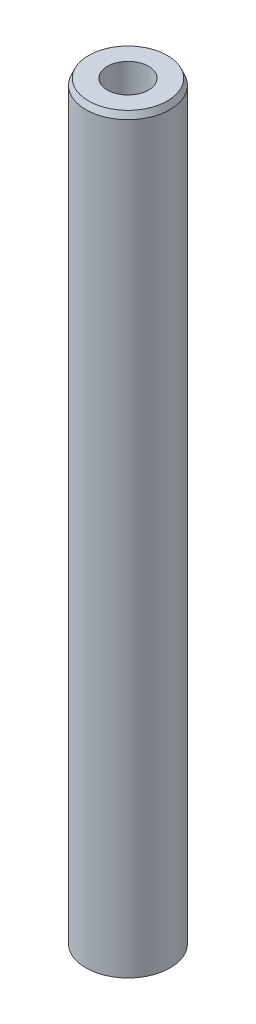
from build123d import *
from OCP.BRepFilletAPI import BRepFilletAPI_MakeChamfer

# Parameters (mm, degrees)
SKETCH1_R           = 12.5
BOSS_EXTRUDE1_DEPTH = 223.278673939
SKETCH2_R           = 6.114380376
CUT_EXTRUDE1_DEPTH  = 224.977378848
CHAMFER1_SIZE       = 1.834008935
CHAMFER1_SIZE2      = 0.799764475


with BuildPart() as part:
    # Sketch1 → Boss-Extrude1 (new body)
    with BuildSketch(Plane(origin=(0, 0, 0), x_dir=(1, 0, 0), z_dir=(0, 1, 0))):
        Circle(SKETCH1_R)
    extrude(amount=BOSS_EXTRUDE1_DEPTH)

    # Sketch2 → Cut-Extrude1 (cut, through all)
    with BuildSketch(Plane(origin=(0, 0, 0), x_dir=(1, 0, 0), z_dir=(0, 1, 0))):
        Circle(SKETCH2_R)
    extrude(amount=CUT_EXTRUDE1_DEPTH, mode=Mode.SUBTRACT)

    # Chamfer1: one chamfer whose edges measure the first distance from different faces: ONE call of the kernel's chamfer builder (chamfer() names one face for all edges)
    chamfer1_edges_1 = [part.edges().sort_by_distance(p)[0] for p in [
        (-12.5, 223.278673939, 0),
    ]]
    chamfer1_side_1 = [part.faces().sort_by_distance(p)[0] for p in [
        (-12.5, 111.639336969, 0),
    ]]
    chamfer1_edges_2 = [part.edges().sort_by_distance(p)[0] for p in [
        (-12.5, 0, 0),
    ]]
    chamfer1_side_2 = [part.faces().sort_by_distance(p)[0] for p in [
        (-12.146446609, 0, 0),
    ]]
    chamfer1 = BRepFilletAPI_MakeChamfer(part.part.solid().wrapped)
    for e in chamfer1_edges_1:
        chamfer1.Add(CHAMFER1_SIZE, CHAMFER1_SIZE2, e.wrapped, chamfer1_side_1[0].wrapped)  # the first distance lies on this face
    for e in chamfer1_edges_2:
        chamfer1.Add(CHAMFER1_SIZE, CHAMFER1_SIZE2, e.wrapped, chamfer1_side_2[0].wrapped)  # the first distance lies on this face
    add(Compound.cast(chamfer1.Shape()), mode=Mode.REPLACE)


solid = part.part
